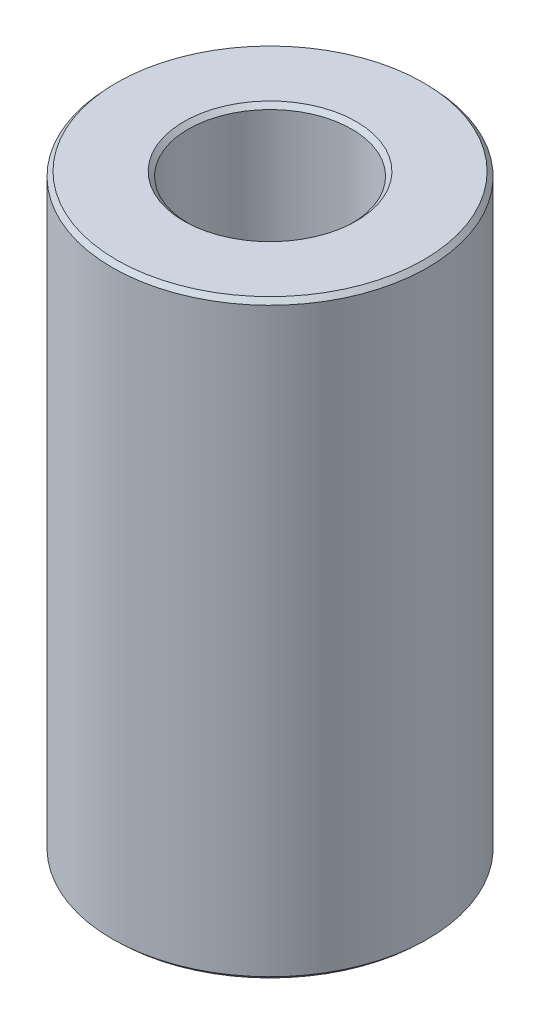
from build123d import *
from OCP.BRepFilletAPI import BRepFilletAPI_MakeChamfer

# Parameters (mm, degrees)
SKETCH1_R           = 45
BOSS_EXTRUDE1_DEPTH = 168.385763559
SKETCH2_R           = 23.310462608
CUT_EXTRUDE1_DEPTH  = 181.010459056
CHAMFER1_SIZE       = 1.282602309
CHAMFER1_SIZE2      = 1.210057345


with BuildPart() as part:
    # Sketch1 → Boss-Extrude1 (new body)
    with BuildSketch(Plane(origin=(0, 0, 0), x_dir=(1, 0, 0), z_dir=(0, 1, 0))):
        Circle(SKETCH1_R)
    extrude(amount=BOSS_EXTRUDE1_DEPTH)

    # Sketch2 → Cut-Extrude1 (cut, through all)
    with BuildSketch(Plane(origin=(0, 0, 0), x_dir=(1, 0, 0), z_dir=(0, 1, 0))):
        Circle(SKETCH2_R)
    extrude(amount=CUT_EXTRUDE1_DEPTH, mode=Mode.SUBTRACT)

    # Chamfer1: one chamfer whose edges measure the first distance from different faces: ONE call of the kernel's chamfer builder (chamfer() names one face for all edges)
    chamfer1_edges_1 = [part.edges().sort_by_distance(p)[0] for p in [
        (-23.310462608, 168.385763559, 0),
    ]]
    chamfer1_side_1 = [part.faces().sort_by_distance(p)[0] for p in [
        (-43.727207794, 168.385763559, 0),
    ]]
    chamfer1_edges_2 = [part.edges().sort_by_distance(p)[0] for p in [
        (-23.310462608, 0, 0),
    ]]
    chamfer1_side_2 = [part.faces().sort_by_distance(p)[0] for p in [
        (-23.310462608, 84.19288178, 0),
    ]]
    chamfer1_edges_3 = [part.edges().sort_by_distance(p)[0] for p in [
        (-45, 0, 0),
    ]]
    chamfer1_side_3 = [part.faces().sort_by_distance(p)[0] for p in [
        (-43.727207794, 0, 0),
    ]]
    chamfer1_edges_4 = [part.edges().sort_by_distance(p)[0] for p in [
        (-45, 168.385763559, 0),
    ]]
    chamfer1_side_4 = [part.faces().sort_by_distance(p)[0] for p in [
        (-45, 84.19288178, 0),
    ]]
    chamfer1 = BRepFilletAPI_MakeChamfer(part.part.solid().wrapped)
    for e in chamfer1_edges_1:
        chamfer1.Add(CHAMFER1_SIZE, CHAMFER1_SIZE2, e.wrapped, chamfer1_side_1[0].wrapped)  # the first distance lies on this face
    for e in chamfer1_edges_2:
        chamfer1.Add(CHAMFER1_SIZE, CHAMFER1_SIZE2, e.wrapped, chamfer1_side_2[0].wrapped)  # the first distance lies on this face
    for e in chamfer1_edges_3:
        chamfer1.Add(CHAMFER1_SIZE, CHAMFER1_SIZE2, e.wrapped, chamfer1_side_3[0].wrapped)  # the first distance lies on this face
    for e in chamfer1_edges_4:
        chamfer1.Add(CHAMFER1_SIZE, CHAMFER1_SIZE2, e.wrapped, chamfer1_side_4[0].wrapped)  # the first distance lies on this face
    add(Compound.cast(chamfer1.Shape()), mode=Mode.REPLACE)


solid = part.part
